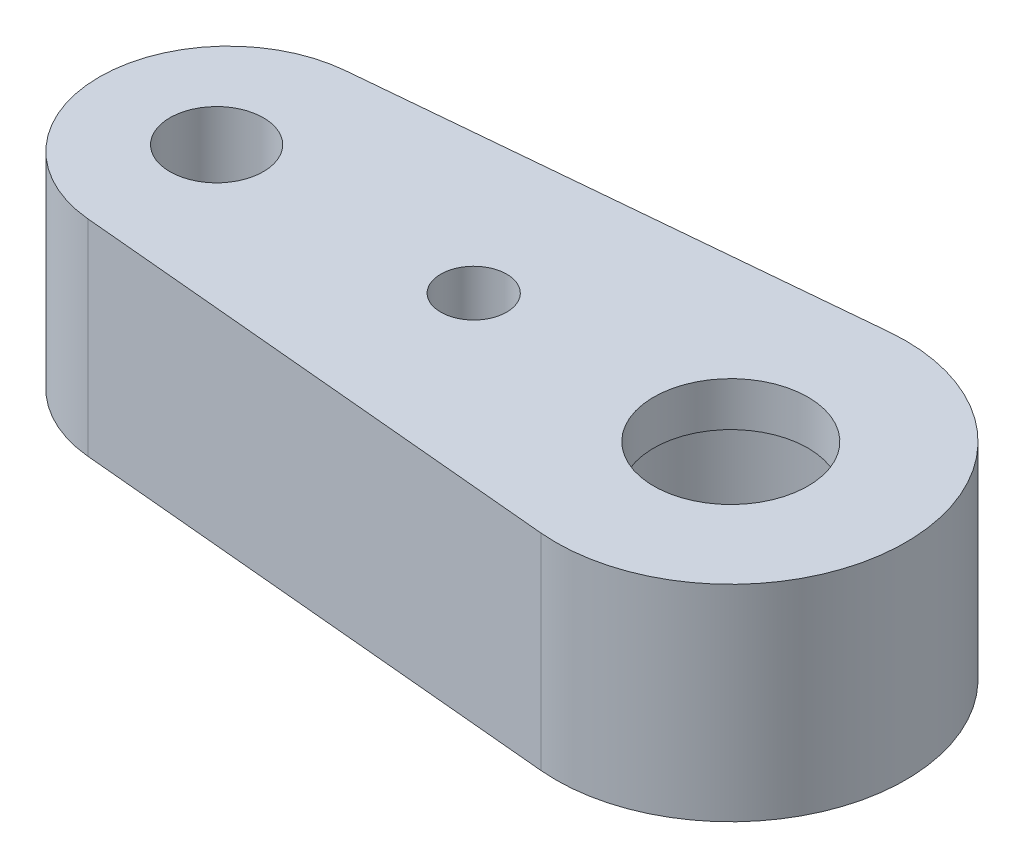
from build123d import *

# Parameters (mm, degrees)
BOSS_EXTRUDE1_DEPTH      = 1
BOSS_EXTRUDE1_DEPTH_BACK = 1
CUT_EXTRUDE1_REACH       = 8.678
SKETCH5_R                = 0.3207
SKETCH5_R_2              = 0.45466


with BuildPart() as part:
    # Sketch1 → Boss-Extrude1 (new, two sides: drawn at the far end of the back side and taken through both)
    with BuildSketch(Plane(origin=(0, 0, 0), x_dir=(1, 0, 0), z_dir=(0, 1, 0)).offset(-BOSS_EXTRUDE1_DEPTH_BACK)):
        with BuildLine():
            Line((-5, 1.25), (-0.154764853, 1.69294059))
            ThreePointArc((-0.154764853, 1.69294059), (1.7, 0), (-0.154764853, -1.69294059))
            Line((-0.154764853, -1.69294059), (-5, -1.25))
            ThreePointArc((-5, -1.25), (-6.140940176, 0), (-5, 1.25))
        make_face()
    extrude(amount=BOSS_EXTRUDE1_DEPTH + BOSS_EXTRUDE1_DEPTH_BACK)

    # Sketch4 → Cut-Revolve1 (revolve, cut)
    with BuildSketch(Plane.XY):
        Polygon((1.145, 0), (1.145, 0.465), (0.75, 0.570839931), (0.75, 1), (0, 1), (0, -1), (0.75, -1), (0.75, -0.570839931), (1.145, -0.465), align=None)
    revolve(axis=Axis((0, -1, 0), (0, 1, 0)), mode=Mode.SUBTRACT)

    # Sketch5 → Cut-Extrude1 (cut, up to next)
    with BuildSketch(Plane(origin=(0, 1, 0), x_dir=(1, 0, 0), z_dir=(0, 1, 0)), mode=Mode.PRIVATE) as cut_extrude1_sk1:
        with Locations((-2.5, 0)):
            Circle(SKETCH5_R)
    cut_extrude1_tool1 = extrude(cut_extrude1_sk1.sketch, amount=-CUT_EXTRUDE1_REACH, mode=Mode.PRIVATE) & part.part
    # Sketch5 → Cut-Extrude1 (cut, up to next)
    with BuildSketch(Plane(origin=(0, 1, 0), x_dir=(1, 0, 0), z_dir=(0, 1, 0)), mode=Mode.PRIVATE) as cut_extrude1_sk2:
        with Locations((-5, 0)):
            Circle(SKETCH5_R_2)
    cut_extrude1_tool2 = extrude(cut_extrude1_sk2.sketch, amount=-CUT_EXTRUDE1_REACH, mode=Mode.PRIVATE) & part.part
    add(cut_extrude1_tool1.solids().sort_by_distance((-2.5, 1, 0))[0], mode=Mode.SUBTRACT)
    add(cut_extrude1_tool2.solids().sort_by_distance((-5, 1, 0))[0], mode=Mode.SUBTRACT)


solid = part.part
